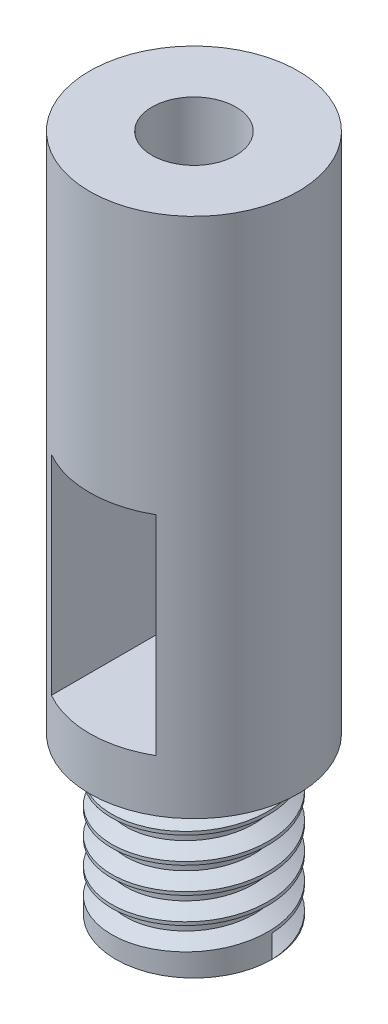
from build123d import *

# Parameters (mm, degrees)
SKETCH1_R                   = 4.7625
BOSS_EXTRUDE1_DEPTH         = 9.525
SKETCH2_R                   = 6.35
BOSS_EXTRUDE2_DEPTH         = 31.75
CUT_EXTRUDE1_DEPTH          = 33.995567884
CUT_EXTRUDE1_DEPTH_BACK     = 33.995567884
SKETCH3_W                   = 6.35
SKETCH3_H                   = 12.7
F_1_4_20_TAPPED_HOLE1_D     = 5.1054
F_1_4_20_TAPPED_HOLE1_DEPTH = 15.875
THREAD1_PITCH               = 1.5875


with BuildPart() as part:
    # Sketch1 → Boss-Extrude1 (new body)
    with BuildSketch(Plane(origin=(0, 0, 0), x_dir=(1, 0, 0), z_dir=(0, 1, 0))):
        with Locations(Location((0, 0, 0), (0, 0, 270))):
            Circle(SKETCH1_R)
    extrude(amount=-BOSS_EXTRUDE1_DEPTH)

    # Sketch2 → Boss-Extrude2 (add)
    with BuildSketch(Plane(origin=(0, 0, 0), x_dir=(1, 0, 0), z_dir=(0, 1, 0))):
        with Locations(Location((0, 0, 0), (0, 0, 270))):
            Circle(SKETCH2_R)
    extrude(amount=BOSS_EXTRUDE2_DEPTH)

    # Sketch3 → Cut-Extrude1 (cut, two sides: drawn at the far end of the back side and taken through both)
    with BuildSketch(Plane.XY.offset(-CUT_EXTRUDE1_DEPTH_BACK)):
        with Locations((0, 9.525)):
            Rectangle(SKETCH3_W, SKETCH3_H)
    extrude(amount=CUT_EXTRUDE1_DEPTH + CUT_EXTRUDE1_DEPTH_BACK, mode=Mode.SUBTRACT)

    # 1/4-20 Tapped Hole1
    with Locations(Plane(origin=(0, 31.75, 0), x_dir=(1, 0, 0), z_dir=(0, 1, 0))):
        with Locations((0, 0)):
            Hole(F_1_4_20_TAPPED_HOLE1_D / 2, depth=F_1_4_20_TAPPED_HOLE1_DEPTH)

    # Thread1: the profile of Thread Profile1 profile screwed along a right-hand helix of 6 turns, 8 arcs to a turn; built about Z, then put on its axis
    thread1_z = Axis((0, 0, 0), (0, 0, 1))
    thread1_corners = [(4.7628, 0, -0.000173205), (4.7628, 0, 1.389235701), (3.903240423, 0, 0.892968748), (3.903240423, 0, 0.496093748)]
    with BuildLine(mode=Mode.PRIVATE) as thread1_profile:
        Line(thread1_corners[0], thread1_corners[1])
        Line(thread1_corners[1], thread1_corners[2])
        Line(thread1_corners[2], thread1_corners[3])
        Line(thread1_corners[3], thread1_corners[0])
    thread1_cap = Face(thread1_profile.wire())
    thread1_turn_angles = [0, 22.5, 45, 67.5, 90, 112.5, 135, 157.5, 180, 202.5, 225, 247.5, 270, 292.5, 315, 337.5, 360]
    thread1_turn_weights = [1, 0.9238795325112867, 1, 0.9238795325112867, 1, 0.9238795325112867, 1, 0.9238795325112867, 1, 0.9238795325112867, 1, 0.9238795325112867, 1, 0.9238795325112867, 1, 0.9238795325112867, 1]
    thread1_turn_rails = [Edge.make_bspline([Vector(p[0], p[1], 0).rotate(thread1_z, thread1_turn_angles[k]) / thread1_turn_weights[k] + Vector(0, 0, p[2] + THREAD1_PITCH * thread1_turn_angles[k] / 360) for k in range(17)], [0, 0, 0, 1, 1, 2, 2, 3, 3, 4, 4, 5, 5, 6, 6, 7, 7, 8, 8, 8], 2, thread1_turn_weights) for p in thread1_corners]
    thread1_turn_sides = [Face.make_surface_from_curves(thread1_turn_rails[p[0]], thread1_turn_rails[p[1]]) for p in [(0, 1), (1, 2), (2, 3), (3, 0)]]
    thread1 = Plane(origin=(0, -9.525, 0), x_dir=(1, 0, 0), z_dir=(0, 1, 0)) * Solid(Shell([*[p.moved(Location((0, 0, THREAD1_PITCH * i))) for i in range(6) for p in thread1_turn_sides], thread1_cap, thread1_cap.rotate(thread1_z, 2160).moved(Location((0, 0, THREAD1_PITCH * 2160 / 360)))]))
    add(thread1, mode=Mode.SUBTRACT)


solid = part.part
